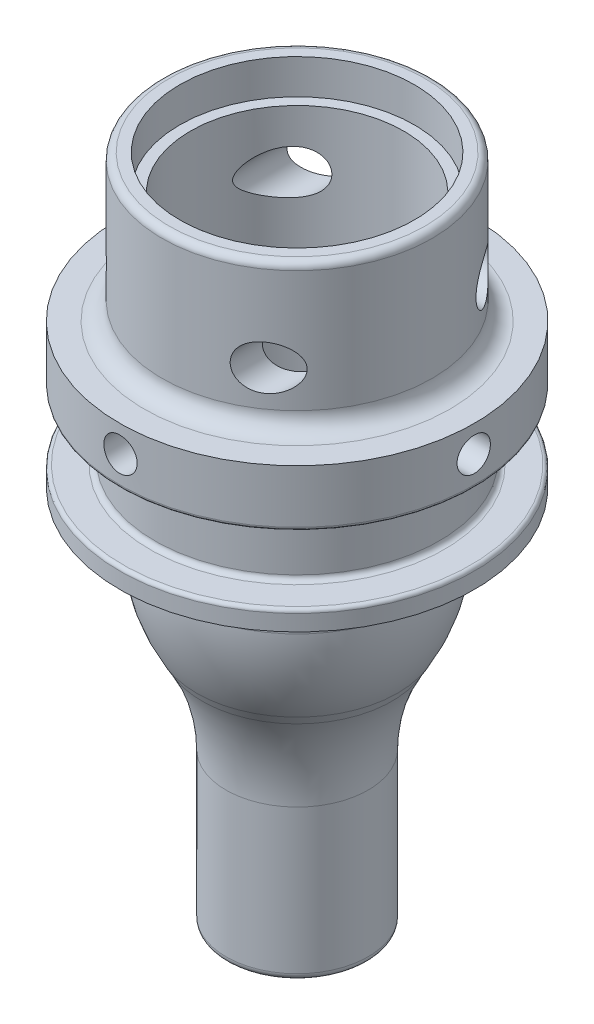
from build123d import *

# Parameters (mm, degrees)
SKETCH3_W         = 0.79375
SKETCH3_H         = 6.3373
CIRPATTERN1_COUNT = 4
CIRPATTERN2_COUNT = 4
FILLET1_R         = 0.254
FILLET2_R         = 6.35
FILLET3_R         = 6.35
FILLET4_R         = 0.635
FILLET5_R         = 0.254
FILLET6_R         = 0.762


with BuildPart() as part:
    # Sketch1 → Revolve1 (revolve)
    with BuildSketch(Plane.XY, mode=Mode.PRIVATE) as revolve1_sk:
        with BuildLine():
            Line((4.826, 23.876), (4.826, 18.6563))
            Line((4.826, 18.6563), (6.3373, 18.6563))
            Line((6.3373, 18.6563), (6.3373, 17.3228))
            Line((6.3373, 17.3228), (6.3373, 16.7513))
            ThreePointArc((6.3373, 16.7513), (6.300102561, 16.661497439), (6.2103, 16.6243))
            Line((6.2103, 16.6243), (5.2578, 16.6243))
            ThreePointArc((5.2578, 16.6243), (5.132076414, 16.572223586), (5.08, 16.4465))
            Line((5.08, 16.4465), (5.08, 14.3891))
            ThreePointArc((5.08, 14.3891), (5.132076414, 14.263376414), (5.2578, 14.2113))
            Line((5.2578, 14.2113), (6.2103, 14.2113))
            ThreePointArc((6.2103, 14.2113), (6.300102561, 14.174102561), (6.3373, 14.0843))
            Line((6.3373, 14.0843), (6.3373, 13.5128))
            Line((6.3373, 13.5128), (5.0673, 13.5128))
            Line((5.0673, 13.5128), (4.445, 13.5128))
            Line((4.445, 13.5128), (4.445, 10.411556788))
            Line((4.445, 10.411556788), (2.54, 7.112))
            Line((2.54, 7.112), (2.54, 0))
            Line((2.54, 0), (2.032, 0))
            Line((2.032, 0), (2.032, 7.331970453))
            Line((2.032, 7.331970453), (3.81, 10.411556788))
            Line((3.81, 10.411556788), (3.81, 22.6314))
            Line((3.81, 22.6314), (4.191, 22.6314))
            Line((4.191, 22.6314), (4.191, 23.876))
            Line((4.191, 23.876), (4.826, 23.876))
        make_face()
    revolve(revolve1_sk.sketch.rotate(Axis((0, 20.955, 0), (0, -1, 0)), 180), axis=Axis((0, 20.955, 0), (0, -1, 0)))

    # Sketch3 → 1/16 (0.0625) Diameter Hole1 (revolve, cut)
    with BuildSketch(Plane(origin=(2.794, 20.574, 0), x_dir=(0, 1, 0), z_dir=(1, 0, 0))):
        with Locations((0.396875, 3.16865)):
            Rectangle(SKETCH3_W, SKETCH3_H)
    f_1_16_0_0625_diameter_hole1 = revolve(axis=Axis((2.794, 20.574, -6.35), (0, 0, 1)), mode=Mode.SUBTRACT)

    # CirPattern1: 1/16 (0.0625) Diameter Hole1 ×4 about axis
    cirpattern1_axis = Axis((0, 20.955, 0), (0, 1, 0))
    for i in range(1, CIRPATTERN1_COUNT):
        add(f_1_16_0_0625_diameter_hole1.rotate(cirpattern1_axis, i * 360 / CIRPATTERN1_COUNT), mode=Mode.SUBTRACT)

    # Sketch7 → #0-80 Tapped Hole1 (revolve, cut)
    with BuildSketch(Plane(origin=(0, 17.7038, 6.3373), x_dir=(0, -1, 0), z_dir=(1, 0, 0))):
        Polygon((0, 0), (0, 2.135890611), (0.59563, 1.778), (0.59563, 0), align=None)
    f_0_80_tapped_hole1 = revolve(axis=Axis((0, 17.7038, 12.6873), (0, 0, -1)), mode=Mode.SUBTRACT)

    # CirPattern2: #0-80 Tapped Hole1 ×4 about axis
    cirpattern2_axis = Axis((0, 0, 0), (0, -1, 0))
    for i in range(1, CIRPATTERN2_COUNT):
        add(f_0_80_tapped_hole1.rotate(cirpattern2_axis, i * 360 / CIRPATTERN2_COUNT), mode=Mode.SUBTRACT)

    # Fillet1
    fillet1_edges = [part.edges().sort_by_distance(p)[0] for p in [
        (4.826, 23.876, 0),
    ]]
    fillet(fillet1_edges, radius=FILLET1_R)

    # Fillet2
    fillet2_edges = [part.edges().sort_by_distance(p)[0] for p in [
        (2.032, 7.331970453, 0),
        (3.81, 10.411556788, 0),
    ]]
    fillet(fillet2_edges, radius=FILLET2_R)

    # Fillet3
    fillet3_edges = [part.edges().sort_by_distance(p)[0] for p in [
        (4.445, 10.411556788, 0),
        (2.54, 7.112, 0),
    ]]
    fillet(fillet3_edges, radius=FILLET3_R)

    # Fillet4
    fillet4_edges = [part.edges().sort_by_distance(p)[0] for p in [
        (4.826, 18.6563, 0),
    ]]
    fillet(fillet4_edges, radius=FILLET4_R)

    # Fillet5
    fillet5_edges = [part.edges().sort_by_distance(p)[0] for p in [
        (2.54, 0, 0),
        (2.032, 0, 0),
    ]]
    fillet(fillet5_edges, radius=FILLET5_R - 0.0001)  # a hair under: the kernel refuses the full size

    # Fillet6
    fillet6_edges = [part.edges().sort_by_distance(p)[0] for p in [
        (4.445, 13.5128, 0),
    ]]
    fillet(fillet6_edges, radius=FILLET6_R)


solid = part.part
